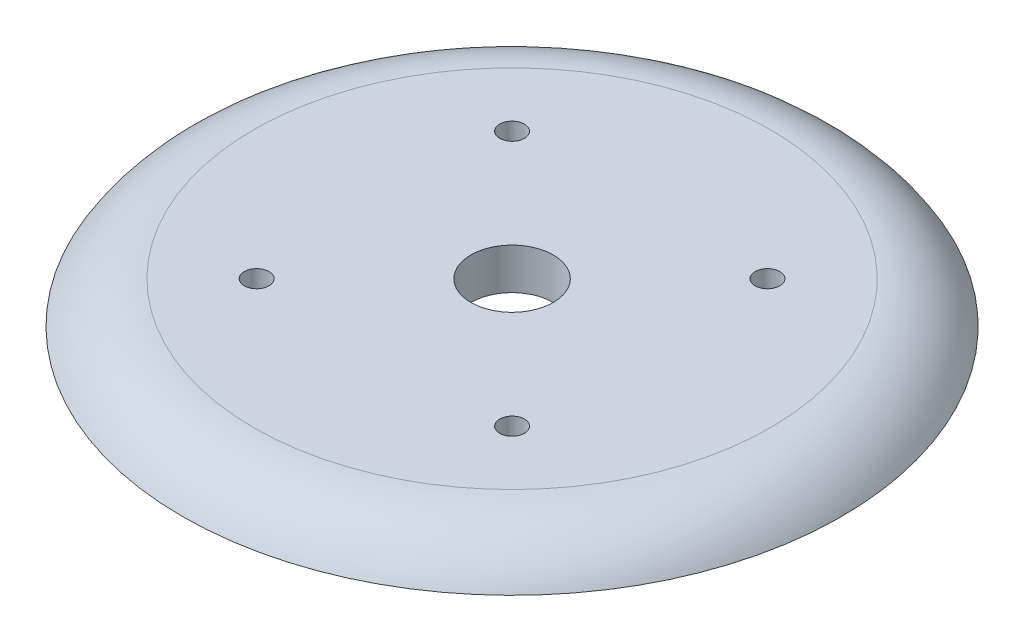
from build123d import *

# Parameters (mm, degrees)
SKETCH1_R           = 40
SKETCH1_R_2         = 1.5
SKETCH1_R_3         = 5
BOSS_EXTRUDE1_DEPTH = 5
FILLET2_R           = 10


with BuildPart() as part:
    # Sketch1 → Boss-Extrude1 (new body)
    with BuildSketch(Plane(origin=(0, 0, 0), x_dir=(1, 0, 0), z_dir=(0, 1, 0))):
        with Locations(Location((0, 0, 0), (0, 0, 270))):
            Circle(SKETCH1_R)
        with Locations(Location((-15.5, 15.5, 0), (0, 0, 270))):
            Circle(SKETCH1_R_2, mode=Mode.SUBTRACT)
        with Locations(Location((15.5, 15.5, 0), (0, 0, 270))):
            Circle(SKETCH1_R_2, mode=Mode.SUBTRACT)
        with Locations(Location((-15.5, -15.5, 0), (0, 0, 270))):
            Circle(SKETCH1_R_2, mode=Mode.SUBTRACT)
        with Locations(Location((15.5, -15.5, 0), (0, 0, 270))):
            Circle(SKETCH1_R_2, mode=Mode.SUBTRACT)
        with Locations(Location((0, 0, 0), (0, 0, 270))):
            Circle(SKETCH1_R_3, mode=Mode.SUBTRACT)
    extrude(amount=BOSS_EXTRUDE1_DEPTH)

    # Fillet2
    # the kernel refuses this fillet: 10 mm, written as the material it takes off along each edge
    with BuildSketch(Plane(origin=(0, 5, 0), x_dir=(0, 0, 1), z_dir=(-1, 0, 0))) as fillet2_piece_1:
        with BuildLine():
            CenterArc((31.339745962, -10), FILLET2_R, 30, 60)
            Line((31.339745962, 0), (31.339745962, 0.2))
            Line((31.339745962, 0.2), (40, 0.2))
            Line((40, 0.2), (40.2, 0))
            ThreePointArc((40.2, 0), (40.2, -2.5), (40.173205081, -4.9))
            Line((40.173205081, -4.9), (40, -5))
        make_face()
    revolve(axis=Axis((0, 5, 0), (0, 1, 0)), mode=Mode.SUBTRACT)


solid = part.part
